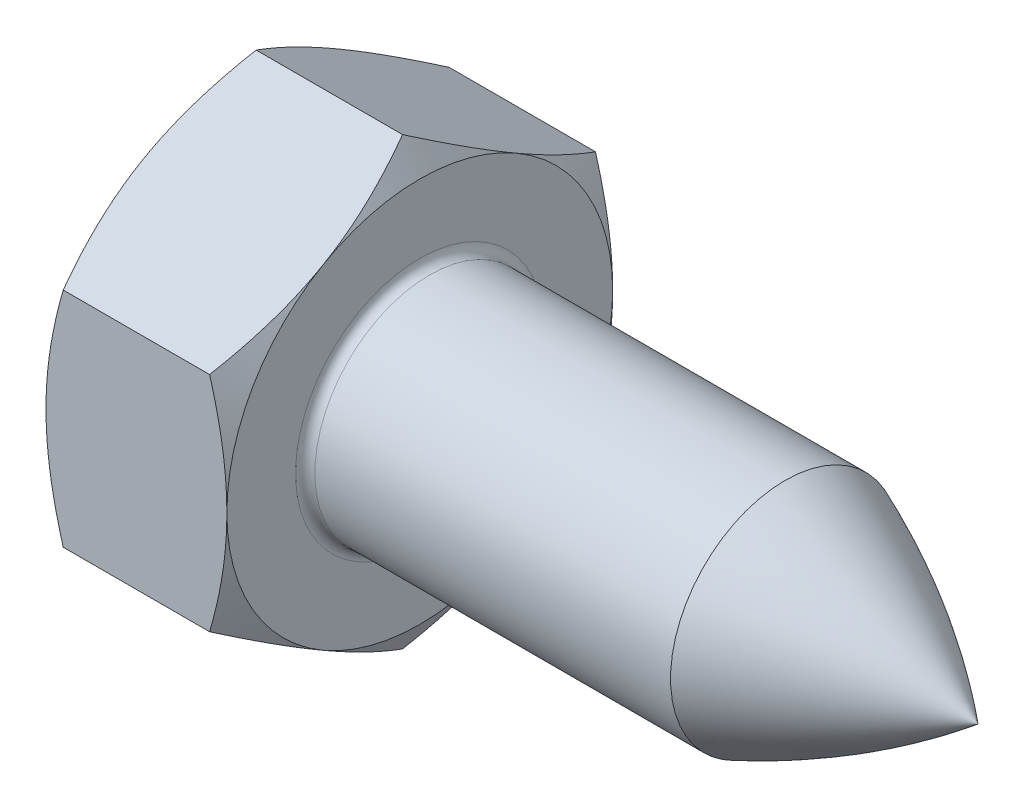
from build123d import *

# Parameters (mm, degrees)
BASEHEAD_DEPTH = 7.5
SKETCH1_W      = 23.15
SKETCH1_H      = 4.75
FILLET1_R      = 0.4
SKETCH6_W      = 1.35
SKETCH6_H      = 6.666666667


with BuildPart() as part:
    # Sketch2 → BaseHead (new body)
    with BuildSketch(Plane(origin=(0, 0, 0), x_dir=(0, 0, -1), z_dir=(1, 0, 0))):
        Polygon((0, 9.237604307), (-8, 4.618802154), (-8, -4.618802154), (0, -9.237604307), (8, -4.618802154), (8, 4.618802154), align=None)
    extrude(amount=BASEHEAD_DEPTH)

    # Sketch1 → BaseBody (revolve)
    with BuildSketch(Plane.XY):
        with Locations((19.075, 2.375)):
            Rectangle(SKETCH1_W, SKETCH1_H)
    revolve(axis=Axis((-9.544470106, 0, 0), (1, 0, 0)))

    # Sketch3 → Cut-Revolve7 (revolve, cut)
    with BuildSketch(Plane.XY):
        Polygon((0, 8), (0.71453118, 9.237604307), (0, 9.237604307), align=None)
        Polygon((7.5, 9.237604307), (7.5, 8), (6.78546882, 9.237604307), align=None)
    revolve(axis=Axis((10.663764742, 0, 0), (-1, 0, 0)), mode=Mode.SUBTRACT)

    # Fillet1
    fillet1_edges = [part.edges().sort_by_distance(p)[0] for p in [
        (7.5, -4.75, 0),
    ]]
    fillet(fillet1_edges, radius=FILLET1_R)

    # Sketch4 → Cut-Revolve1 (revolve, cut)
    with BuildSketch(Plane.XY):
        Polygon((26.45, -4.75), (28.55, -4.75), (30.65, -4.225), (30.65, -5.25), (26.45, -5.25), align=None)
    revolve(axis=Axis((31.978193536, 0, 0), (-1, 0, 0)), mode=Mode.SUBTRACT)

    # Sketch5 → Cut-Revolve6 (revolve, cut)
    with BuildSketch(Plane.XY):
        with BuildLine():
            Line((30.65, 0), (31.15, 0))
            Line((31.15, 0), (31.15, -4.75))
            Line((31.15, -4.75), (30.65, -4.75))
            Line((30.65, -4.75), (22.65, -4.75))
            ThreePointArc((22.65, -4.75), (26.823552739, -2.66729935), (30.65, 0))
        make_face()
    revolve(axis=Axis((33.390663239, 0, 0), (-1, 0, 0)), mode=Mode.SUBTRACT)

    # Sketch6 → Cut-Revolve8 (revolve, cut)
    with BuildSketch(Plane.XY):
        with Locations((0.575, 3.333333334)):
            Rectangle(SKETCH6_W, SKETCH6_H)
    revolve(axis=Axis((0, 0, 0), (-1, 0, 0)), mode=Mode.SUBTRACT)


solid = part.part
